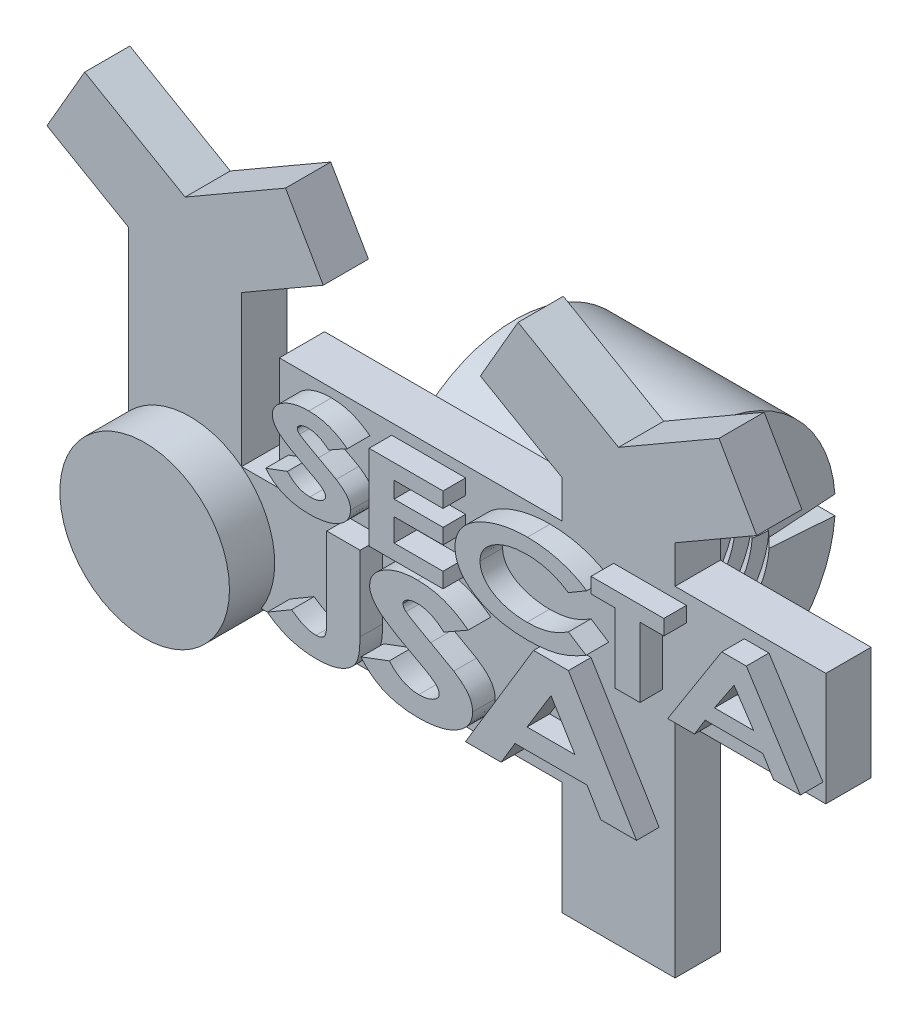
from build123d import *

# Parameters (mm, degrees)
SALIENTE_EXTRUIR1_DEPTH      = 2.4
SALIENTE_EXTRUIR2_DEPTH      = 2.4
SALIENTE_EXTRUIR2_DEPTH_BACK = 2.4
CROQUIS2_R                   = 4.5
SALIENTE_EXTRUIR3_DEPTH      = 1.2
SALIENTE_EXTRUIR4_START      = -15.5
SALIENTE_EXTRUIR4_DEPTH      = 10
REVOLUCI_N2_ANGLE            = 351.828766
SALIENTE_EXTRUIR5_DEPTH      = 1.2


# Read off the part's stored shape, not the designer's step: Revolución2
with BuildPart() as part:
    # Croquis1 → Saliente-Extruir1 (new body)
    with BuildSketch(Plane.XY):
        Polygon((-8, -12), (-14, -12), (-14, -6), (-37, -6), (-37, 8), (-41.330127019, 10.5), (-39.330127019, 13.964101615), (-34, 10.886751346), (-28.669872981, 13.964101615), (-26.669872981, 10.5), (-31, 8), (-31, 0), (-29, 0), (-29, 6), (-14, 6), (-14, 8), (-18.330127019, 10.5), (-16.330127019, 13.964101615), (-11, 10.886751346), (-5.669872981, 13.964101615), (-3.669872981, 10.5), (-8, 8), (-8, 6), (0, 6), (0, 0), (-8, 0), align=None)
    extrude(amount=SALIENTE_EXTRUIR1_DEPTH)

    # Croquis2 → Saliente-Extruir2 (add, two sides: drawn at the far end of the back side and taken through both)
    with BuildSketch(Plane.XY.offset(2.4).offset(-SALIENTE_EXTRUIR2_DEPTH_BACK)):
        with Locations((-33.744908232, -3.565877002)):
            Circle(CROQUIS2_R)
    extrude(amount=SALIENTE_EXTRUIR2_DEPTH + SALIENTE_EXTRUIR2_DEPTH_BACK)

    # Croquis4 → Saliente-Extruir3 (add)
    # profile 1 of 5: a face of its own
    with BuildSketch(Plane.XY.offset(2.4)):
        with BuildLine():
            Line((-24.192307692, 4.825075565), (-25.183894231, 4.27249143))
            add(Edge.make_bspline(
                [(-25.183894231, 4.27249143), (-25.226919521, 4.309235401), (-25.310921586, 4.380973891), (-25.44300624, 4.474503478), (-25.57494017, 4.554736812), (-25.707934149, 4.620047496), (-25.841884622, 4.67105453), (-25.976583426, 4.707083688), (-26.111905597, 4.729870519), (-26.20243685, 4.732645607), (-26.247596154, 4.734029892)],
                knots=[0, 0, 0, 0, 1.144796943, 2.235087903, 3.271950806, 4.267549238, 5.230026978, 6.168390537, 7.086346384, 8, 8, 8, 8], degree=3))
            add(Edge.make_bspline(
                [(-26.247596154, 4.734029892), (-26.289424602, 4.733153893), (-26.369562474, 4.731475594), (-26.484031555, 4.714354255), (-26.586771926, 4.685665755), (-26.6761846, 4.647005328), (-26.748660996, 4.600831216), (-26.803911953, 4.552167689), (-26.838911098, 4.497375224), (-26.84382007, 4.457984847), (-26.846153846, 4.439258257)],
                knots=[0, 0, 0, 0, 1.392129176, 2.667138632, 3.84227936, 4.935454925, 5.89858118, 6.691521191, 7.377935727, 8, 8, 8, 8], degree=3))
            add(Edge.make_bspline(
                [(-26.846153846, 4.439258257), (-26.844845537, 4.420373796), (-26.842149476, 4.381458201), (-26.816134665, 4.325733024), (-26.777704966, 4.271256116), (-26.742929276, 4.240270627), (-26.724459135, 4.223813546)],
                knots=[0, 0, 0, 0, 0.882707917, 1.819014285, 2.841630067, 4, 4, 4, 4], degree=3))
            add(Edge.make_bspline(
                [(-26.724459135, 4.223813546), (-26.70716928, 4.210697442), (-26.66689923, 4.180148536), (-26.59337581, 4.132820466), (-26.500289619, 4.0742192), (-26.385267259, 4.007155467), (-26.250202075, 3.929117481), (-26.092994818, 3.843681459), (-25.91659167, 3.74531642), (-25.790990693, 3.678511715), (-25.724759615, 3.643284699)],
                knots=[0, 0, 0, 0, 0.450074539, 1.048275106, 1.812777656, 2.732189609, 3.810011812, 5.048794557, 6.443789853, 8, 8, 8, 8], degree=3))
            add(Edge.make_bspline(
                [(-25.724759615, 3.643284699), (-25.662851598, 3.61054962), (-25.545567289, 3.548533238), (-25.379215317, 3.460234009), (-25.232592385, 3.380629208), (-25.104381152, 3.311837263), (-24.996313352, 3.251000464), (-24.90672063, 3.20082688), (-24.836479309, 3.15950506), (-24.796241404, 3.134624323), (-24.779146635, 3.12405393)],
                knots=[0, 0, 0, 0, 1.557729856, 2.951108395, 4.189202345, 5.268860485, 6.187465346, 6.947688418, 7.552933379, 8, 8, 8, 8], degree=3))
            add(Edge.make_bspline(
                [(-24.779146635, 3.12405393), (-24.745624529, 3.102367723), (-24.680599264, 3.060301409), (-24.588625488, 2.994912237), (-24.503390955, 2.931503644), (-24.427229566, 2.867043774), (-24.357014925, 2.805015658), (-24.29466236, 2.742739252), (-24.239952943, 2.680948997), (-24.177464976, 2.600954471), (-24.114353967, 2.498189698), (-24.058957494, 2.368077238), (-24.025432867, 2.231810055), (-24.021303487, 2.138659077), (-24.019230769, 2.091902488)],
                knots=[0, 0, 0, 0, 1.070878652, 2.077261218, 3.026806543, 3.919535016, 4.752941277, 5.539501526, 6.28186576, 6.965498631, 8.260851439, 9.503440935, 10.746866769, 12, 12, 12, 12], degree=3))
            add(Edge.make_bspline(
                [(-24.019230769, 2.091902488), (-24.021225883, 2.046388603), (-24.025162066, 1.956593709), (-24.053916989, 1.824825276), (-24.101962891, 1.699615496), (-24.170078124, 1.580956355), (-24.25688378, 1.468643362), (-24.361997442, 1.361487696), (-24.488019379, 1.263070384), (-24.629645969, 1.169520308), (-24.787082803, 1.085611466), (-24.956963559, 1.011461598), (-25.138821289, 0.94934789), (-25.33212297, 0.899368812), (-25.536835489, 0.859635813), (-25.752947944, 0.83114072), (-25.980779388, 0.81366997), (-26.136386151, 0.811872926), (-26.216045673, 0.810952969)],
                knots=[0, 0, 0, 0, 0.778645729, 1.536199556, 2.296471887, 3.065788088, 3.869161519, 4.720163113, 5.627776405, 6.600599383, 7.622238928, 8.677086202, 9.770036052, 10.907689888, 12.091823603, 13.337058766, 14.636764725, 16, 16, 16, 16], degree=3))
            add(Edge.make_bspline(
                [(-26.216045673, 0.810952969), (-26.278862692, 0.811613903), (-26.402188738, 0.812911487), (-26.584138058, 0.824072309), (-26.75981156, 0.841825212), (-26.929760665, 0.867140244), (-27.09350231, 0.899245573), (-27.251131566, 0.939142332), (-27.402545238, 0.985888772), (-27.54819372, 1.039742336), (-27.687679504, 1.102538784), (-27.822154113, 1.17262053), (-27.951366726, 1.251594628), (-28.076264597, 1.337864302), (-28.194814057, 1.433872974), (-28.309206927, 1.536758813), (-28.417527902, 1.648872099), (-28.485118563, 1.728831552), (-28.519230769, 1.769186142)],
                knots=[0, 0, 0, 0, 1.1656978, 2.288566092, 3.381684239, 4.4416263, 5.476209922, 6.477059963, 7.457759757, 8.415892537, 9.356930802, 10.29479133, 11.228214832, 12.165660798, 13.10971789, 14.057260176, 15.019522194, 16, 16, 16, 16], degree=3))
            Line((-28.519230769, 1.769186142), (-27.369891827, 2.195568353))
            add(Edge.make_bspline(
                [(-27.369891827, 2.195568353), (-27.326878803, 2.149617425), (-27.242766395, 2.059759915), (-27.104823389, 1.942623324), (-26.962827441, 1.842220632), (-26.815241766, 1.760731057), (-26.662944246, 1.696978834), (-26.505695985, 1.651714203), (-26.343252193, 1.623681536), (-26.232984667, 1.620335505), (-26.177283654, 1.618645276)],
                knots=[0, 0, 0, 0, 1.104549774, 2.159958392, 3.171518491, 4.154034384, 5.11440821, 6.064653456, 7.02237072, 8, 8, 8, 8], degree=3))
            add(Edge.make_bspline(
                [(-26.177283654, 1.618645276), (-26.120989658, 1.62005089), (-26.012343754, 1.622763687), (-25.85664514, 1.64771586), (-25.713942821, 1.686386449), (-25.607218871, 1.734622992), (-25.53095931, 1.778258902), (-25.482277778, 1.812604775), (-25.440114595, 1.847701985), (-25.405740827, 1.884529266), (-25.378809327, 1.92260654), (-25.360756038, 1.962489796), (-25.347985789, 2.003075864), (-25.346761569, 2.031110582), (-25.346153846, 2.045027488)],
                knots=[0, 0, 0, 0, 2.000080528, 3.860101882, 5.591711695, 7.241573856, 8.007496713, 8.712915002, 9.3571957, 9.95440764, 10.499672279, 11.006310789, 11.506715953, 12, 12, 12, 12], degree=3))
            add(Edge.make_bspline(
                [(-25.346153846, 2.045027488), (-25.348239201, 2.070942283), (-25.352586387, 2.124964954), (-25.390964671, 2.203007862), (-25.448179949, 2.280722516), (-25.514214503, 2.343308112), (-25.582059449, 2.395058844), (-25.647383562, 2.441422812), (-25.726444628, 2.492094868), (-25.819005406, 2.548325637), (-25.925335169, 2.609220624), (-26.044860486, 2.67577012), (-26.17800202, 2.747266769), (-26.271568792, 2.795754085), (-26.320612981, 2.821169315)],
                knots=[0, 0, 0, 0, 0.719620744, 1.500140495, 2.382110041, 3.407752025, 4.023146351, 4.762800511, 5.641737031, 6.64237355, 7.784062873, 9.059959673, 10.45894125, 12, 12, 12, 12], degree=3))
            add(Edge.make_bspline(
                [(-26.320612981, 2.821169315), (-26.368459463, 2.84567455), (-26.462008447, 2.89358695), (-26.598052081, 2.966124363), (-26.728282458, 3.035606872), (-26.852361866, 3.102717503), (-26.969340368, 3.16861793), (-27.079874913, 3.232097137), (-27.184213841, 3.292789495), (-27.281477135, 3.352655417), (-27.372939784, 3.409563727), (-27.457987116, 3.463803993), (-27.536153138, 3.516806133), (-27.608250882, 3.56691886), (-27.673715651, 3.615399427), (-27.732827542, 3.661463412), (-27.784903573, 3.705640291), (-27.845809442, 3.760123378), (-27.91153798, 3.827869305), (-27.981090217, 3.909608617), (-28.039650506, 3.991311051), (-28.088116794, 4.07325264), (-28.126508849, 4.154820462), (-28.152520589, 4.237055511), (-28.169956374, 4.318632083), (-28.172042788, 4.37336685), (-28.173076923, 4.400496238)],
                knots=[0, 0, 0, 0, 1.527752317, 2.987046655, 4.381534809, 5.722815918, 6.996037519, 8.197198144, 9.345466108, 10.426340658, 11.442891163, 12.407010941, 13.292840506, 14.126765819, 14.902190045, 15.60773904, 16.256140062, 16.842652159, 17.929649168, 18.935598672, 19.890598399, 20.782540177, 21.638432253, 22.445922123, 23.229718433, 24, 24, 24, 24], degree=3))
            add(Edge.make_bspline(
                [(-28.173076923, 4.400496238), (-28.171332958, 4.439115335), (-28.167872434, 4.515746655), (-28.140274372, 4.628176318), (-28.096954996, 4.736645399), (-28.034402099, 4.840036268), (-27.954790236, 4.939178338), (-27.857594728, 5.03372198), (-27.743147048, 5.123864571), (-27.613030887, 5.208721489), (-27.469978861, 5.28611098), (-27.317394775, 5.354995406), (-27.156225026, 5.412373324), (-26.987382795, 5.460394313), (-26.810220466, 5.497174122), (-26.625035089, 5.523120736), (-26.431752744, 5.538517619), (-26.300208347, 5.540640417), (-26.233173077, 5.541722199)],
                knots=[0, 0, 0, 0, 0.750986067, 1.490170878, 2.240724014, 3.017156197, 3.83291239, 4.709793601, 5.650705905, 6.664670556, 7.729957895, 8.813839263, 9.920261115, 11.057155333, 12.228423976, 13.439459984, 14.695144019, 16, 16, 16, 16], degree=3))
            add(Edge.make_bspline(
                [(-26.233173077, 5.541722199), (-26.1459499, 5.539811999), (-25.973426712, 5.536033716), (-25.71789947, 5.506014802), (-25.468743649, 5.458927461), (-25.265554368, 5.401927605), (-25.104286181, 5.345639344), (-24.980879285, 5.295174591), (-24.855593259, 5.235928582), (-24.726973154, 5.170437519), (-24.596827454, 5.094993964), (-24.463217184, 5.013324641), (-24.327779063, 4.922853281), (-24.238080357, 4.85811241), (-24.192307692, 4.825075565)],
                knots=[0, 0, 0, 0, 1.424089512, 2.816779558, 4.195891129, 5.561527259, 6.25835624, 6.984627267, 7.737611116, 8.521108524, 9.34096556, 10.193521101, 11.07816558, 12, 12, 12, 12], degree=3))
        make_face()
    # profile 2 of 5: a face of its own
    with BuildSketch(Plane.XY.offset(2.4)):
        Polygon((-23.035576923, 5.426337584), (-19.1125, 5.426337584), (-19.1125, 4.618645276), (-21.708653846, 4.618645276), (-21.708653846, 3.753260661), (-19.1125, 3.753260661), (-19.1125, 2.945568353), (-21.708653846, 2.945568353), (-21.708653846, 1.734029892), (-19.1125, 1.734029892), (-19.1125, 0.926337584), (-23.035576923, 0.926337584), align=None)
    # profile 3 of 5: a face of its own
    with BuildSketch(Plane.XY.offset(2.4)):
        with BuildLine():
            Line((-11.494230769, 4.645688546), (-12.461478365, 4.079582776))
            add(Edge.make_bspline(
                [(-12.461478365, 4.079582776), (-12.544289436, 4.131887712), (-12.70893723, 4.235882169), (-12.967709373, 4.369570214), (-13.2349627, 4.481070871), (-13.508945238, 4.574844948), (-13.791643594, 4.64568237), (-14.081359757, 4.697070998), (-14.379043474, 4.728675173), (-14.580090964, 4.732231823), (-14.681730769, 4.734029892)],
                knots=[0, 0, 0, 0, 1.000465043, 1.98915872, 2.971640436, 3.957111076, 4.945256385, 5.94622067, 6.961709345, 8, 8, 8, 8], degree=3))
            add(Edge.make_bspline(
                [(-14.681730769, 4.734029892), (-14.766807302, 4.732614733), (-14.933613121, 4.729840095), (-15.178736129, 4.708948819), (-15.41352726, 4.673751146), (-15.638708179, 4.625507751), (-15.853448947, 4.562274824), (-16.058280977, 4.48569033), (-16.25235326, 4.394501415), (-16.434067486, 4.290723345), (-16.600277398, 4.177562223), (-16.746196027, 4.055929366), (-16.870201552, 3.927577603), (-16.971329203, 3.792162), (-17.051341788, 3.650423272), (-17.107374496, 3.501164008), (-17.142253146, 3.345315182), (-17.146123081, 3.239018692), (-17.148076923, 3.185352007)],
                knots=[0, 0, 0, 0, 1.273167119, 2.496242804, 3.678550535, 4.824339787, 5.939965159, 7.025799381, 8.094030328, 9.145459928, 10.154579224, 11.099447358, 11.983659447, 12.819211474, 13.622469174, 14.41092516, 15.197712182, 16, 16, 16, 16], degree=3))
            add(Edge.make_bspline(
                [(-17.148076923, 3.185352007), (-17.147415614, 3.147727083), (-17.146108387, 3.073352918), (-17.129475318, 2.96370395), (-17.106065882, 2.856804626), (-17.070101266, 2.75393244), (-17.025862091, 2.65391101), (-16.971328936, 2.557174091), (-16.907261742, 2.463244728), (-16.833169017, 2.37324015), (-16.74995472, 2.287330187), (-16.657794645, 2.206639788), (-16.558275277, 2.129695963), (-16.45080782, 2.057129788), (-16.334226304, 1.991157083), (-16.210216908, 1.928324455), (-16.077791861, 1.871334993), (-15.938537212, 1.817777173), (-15.792564168, 1.771701839), (-15.642458064, 1.729774273), (-15.487700082, 1.69568223), (-15.329102464, 1.668203354), (-15.166867918, 1.644955994), (-15.000433419, 1.63053195), (-14.830012806, 1.619621949), (-14.714802376, 1.618973486), (-14.656490385, 1.618645276)],
                knots=[0, 0, 0, 0, 0.830945717, 1.642551973, 2.446594014, 3.246896049, 4.046756933, 4.861591236, 5.698014292, 6.556999256, 7.435410672, 8.338952563, 9.262321444, 10.214761384, 11.20258315, 12.221471147, 13.286409055, 14.388022435, 15.518142965, 16.668710983, 17.832243558, 19.019275871, 20.22635821, 21.453738207, 22.71124865, 24, 24, 24, 24], degree=3))
            add(Edge.make_bspline(
                [(-14.656490385, 1.618645276), (-14.558479025, 1.620411909), (-14.366006122, 1.623881189), (-14.084005172, 1.650038065), (-13.814796067, 1.694421697), (-13.598352905, 1.745650094), (-13.428470487, 1.797304223), (-13.29967663, 1.845079594), (-13.16705737, 1.897774166), (-13.031696922, 1.95876245), (-12.892716193, 2.025958407), (-12.751716033, 2.102246686), (-12.606883075, 2.184160309), (-12.51058721, 2.243056557), (-12.461478365, 2.273092392)],
                knots=[0, 0, 0, 0, 1.517099692, 2.97925243, 4.379421106, 5.737784246, 6.419017464, 7.126793621, 7.863581755, 8.627744198, 9.42450828, 10.252748223, 11.108938718, 12, 12, 12, 12], degree=3))
            Line((-12.461478365, 2.273092392), (-11.523978365, 1.670027488))
            add(Edge.make_bspline(
                [(-11.523978365, 1.670027488), (-11.589866389, 1.63089097), (-11.719693426, 1.55377562), (-11.915195728, 1.446317988), (-12.108473976, 1.34948377), (-12.297754192, 1.259261056), (-12.485165811, 1.179927018), (-12.670221171, 1.111080552), (-12.851582723, 1.048595885), (-13.032422653, 0.997560002), (-13.21480409, 0.952437403), (-13.402047536, 0.915306611), (-13.595238215, 0.882366907), (-13.794974582, 0.856691538), (-14.000848718, 0.835695517), (-14.213133376, 0.821796079), (-14.43134112, 0.812187513), (-14.578955449, 0.81136827), (-14.653786058, 0.810952969)],
                knots=[0, 0, 0, 0, 1.116919084, 2.20079896, 3.250609473, 4.267388355, 5.256504417, 6.215552819, 7.144850743, 8.051425286, 8.95323759, 9.882566473, 10.832956071, 11.809130983, 12.817090507, 13.848664173, 14.909416376, 16, 16, 16, 16], degree=3))
            add(Edge.make_bspline(
                [(-14.653786058, 0.810952969), (-14.722906065, 0.811438621), (-14.859691786, 0.812399709), (-15.062555949, 0.821077022), (-15.260983826, 0.833250386), (-15.454582999, 0.851296303), (-15.643403282, 0.874597786), (-15.827259539, 0.903853507), (-16.00674088, 0.936332544), (-16.180825441, 0.976788095), (-16.350605366, 1.020454944), (-16.515219787, 1.070284035), (-16.675796791, 1.124137214), (-16.830986852, 1.184720215), (-16.98194907, 1.249284398), (-17.127583541, 1.320151969), (-17.268666888, 1.395536662), (-17.404785058, 1.475557845), (-17.533832281, 1.55977608), (-17.655328935, 1.647304488), (-17.767608154, 1.738530782), (-17.872942194, 1.831381532), (-17.969705449, 1.927659287), (-18.056733746, 2.028066389), (-18.136984543, 2.130125749), (-18.207982429, 2.23578825), (-18.271536331, 2.343875109), (-18.325588208, 2.45528507), (-18.371881381, 2.569350723), (-18.409889173, 2.686463496), (-18.438566401, 2.80681331), (-18.459258447, 2.929679867), (-18.472299239, 3.055565471), (-18.474092593, 3.140548909), (-18.475, 3.183549122)],
                knots=[0, 0, 0, 0, 1.332695775, 2.637351488, 3.914573827, 5.165626706, 6.385872522, 7.582268218, 8.755001435, 9.901903064, 11.027533841, 12.134657037, 13.217484645, 14.292362361, 15.346028539, 16.38254251, 17.414187142, 18.429713001, 19.426050768, 20.38448865, 21.315585414, 22.214377371, 23.09110566, 23.945180852, 24.774994998, 25.592932072, 26.397837579, 27.190746929, 27.978303889, 28.769836126, 29.562406716, 30.361557218, 31.170975064, 32, 32, 32, 32], degree=3))
            add(Edge.make_bspline(
                [(-18.475, 3.183549122), (-18.473785493, 3.238925736), (-18.471371684, 3.348985679), (-18.446835338, 3.511020848), (-18.408980933, 3.668635775), (-18.355790343, 3.821267368), (-18.28636546, 3.9692084), (-18.202723551, 4.112393918), (-18.103189381, 4.250700647), (-17.988581396, 4.383672271), (-17.859872774, 4.511467458), (-17.71720785, 4.632192986), (-17.563026633, 4.748488266), (-17.393828314, 4.855888833), (-17.21236255, 4.957872305), (-17.017950151, 5.05352182), (-16.810256436, 5.142613144), (-16.59063275, 5.224912925), (-16.362332555, 5.299148216), (-16.12837035, 5.364251973), (-15.889855412, 5.419259798), (-15.647178925, 5.464408476), (-15.399824695, 5.498220768), (-15.148529856, 5.52396688), (-14.892531391, 5.538130641), (-14.720508462, 5.540519988), (-14.633954327, 5.541722199)],
                knots=[0, 0, 0, 0, 0.802734483, 1.595419208, 2.3713548, 3.151550955, 3.93542733, 4.738280132, 5.553519112, 6.40352961, 7.281897666, 8.181549112, 9.112540013, 10.080976543, 11.086002615, 12.130796417, 13.222189586, 14.362844853, 15.53167316, 16.70335042, 17.8843298, 19.081152094, 20.282513389, 21.504662868, 22.744459539, 24, 24, 24, 24], degree=3))
            add(Edge.make_bspline(
                [(-14.633954327, 5.541722199), (-14.560022202, 5.541038651), (-14.412680101, 5.539676383), (-14.192915704, 5.528419291), (-13.974866237, 5.510811627), (-13.759430794, 5.484144557), (-13.545483627, 5.45221806), (-13.334339569, 5.411070758), (-13.124506008, 5.364772576), (-12.918162654, 5.309484781), (-12.715876611, 5.248900726), (-12.520332919, 5.18093532), (-12.331084533, 5.108255242), (-12.149648163, 5.028005632), (-11.974851405, 4.94211841), (-11.807351876, 4.850530483), (-11.646999565, 4.75209108), (-11.544984001, 4.681037862), (-11.494230769, 4.645688546)],
                knots=[0, 0, 0, 0, 1.07027023, 2.132981633, 3.184963682, 4.2365859, 5.275089204, 6.31594048, 7.35020766, 8.385325281, 9.407824875, 10.406591267, 11.38165812, 12.34189163, 13.277662355, 14.200461515, 15.104720988, 16, 16, 16, 16], degree=3))
        make_face()
    # profile 4 of 5: a face of its own
    with BuildSketch(Plane.XY.offset(2.4)):
        Polygon((-11.260576923, 5.426337584), (-7.395192308, 5.426337584), (-7.395192308, 4.618645276), (-8.664423077, 4.618645276), (-8.664423077, 0.926337584), (-9.991346154, 0.926337584), (-9.991346154, 4.618645276), (-11.260576923, 4.618645276), align=None)
    # profile 5 of 5: a face of its own
    with BuildSketch(Plane.XY.offset(2.4)):
        Polygon((-4.322896635, 5.426337584), (-3.017608173, 5.426337584), (-0.151923077, 0.926337584), (-1.574399038, 0.926337584), (-2.138701923, 1.849414507), (-5.204507212, 1.849414507), (-5.768810096, 0.926337584), (-7.190384615, 0.926337584), align=None)
        Polygon((-3.671153846, 4.219306334), (-4.710516827, 2.657106815), (-2.631790865, 2.657106815), align=None, mode=Mode.SUBTRACT)
    extrude(amount=SALIENTE_EXTRUIR3_DEPTH)

    # Croquis5 → Saliente-Extruir4 (add)
    with BuildSketch(Plane.ZY.offset(29).offset(SALIENTE_EXTRUIR4_START)):
        with BuildLine():
            Line((0, 5.276362383), (0, -5.276362383))
            ThreePointArc((0, -5.276362383), (-7.269302632, -6.471075912), (-11.582210899, -0.49872935))
            Line((-11.582210899, -0.49872935), (-9.088564149, -0.320611725))
            ThreePointArc((-9.088564149, -0.320611725), (-0.1, 0), (-9.088564149, 0.320611725))
            Line((-9.088564149, 0.320611725), (-11.582210899, 0.49872935))
            ThreePointArc((-11.582210899, 0.49872935), (-7.269302632, 6.471075912), (0, 5.276362383))
        make_face()
    extrude(amount=SALIENTE_EXTRUIR4_DEPTH)

    # Revolución2 outline → Revolución2 (revolve)
    with BuildSketch(Plane(origin=(0, 0, -4.6), x_dir=(0, 0.07124704998789502, -0.9974586998307361), z_dir=(0, -0.9974586998307361, -0.07124704998789502))):
        Polygon((4.4, -22.6), (3.5, -23.5), (4.5, -23.5), (4.5, -18.9), (3.5, -19.9), (4.4, -19.9), (3.5, -20.8), (4.4, -20.8), (3.5, -21.7), (4.4, -21.7), (3.5, -22.6), align=None)
        Polygon((3.5, -17.1), (4.5, -18.1), (4.5, -13.5), (3.5, -13.5), (4.4, -14.4), (3.5, -14.4), (4.4, -15.3), (3.5, -15.3), (4.4, -16.2), (3.5, -16.2), (4.4, -17.1), align=None)
    revolve(axis=Axis((0, 0, -4.6), (1, 0, 0)), revolution_arc=REVOLUCI_N2_ANGLE)

    # Croquis8 → Saliente-Extruir5 (add)
    # profile 1 of 3: a face of its own
    with BuildSketch(Plane.XY.offset(2.4)):
        with BuildLine():
            Line((-25.283369771, 0.5), (-23.514139002, 0.5))
            Line((-23.514139002, 0.5), (-23.514139002, -3.483173077))
            add(Edge.make_bspline(
                [(-23.514139002, -3.483173077), (-23.514763901, -3.559310957), (-23.51596834, -3.706059909), (-23.526974415, -3.917338613), (-23.543884806, -4.111249863), (-23.570937821, -4.286763534), (-23.602048675, -4.445448568), (-23.643313184, -4.585785394), (-23.688823682, -4.709946518), (-23.74583379, -4.817042142), (-23.810948948, -4.912106881), (-23.884021861, -5.001121341), (-23.96661189, -5.084659641), (-24.059300003, -5.163544877), (-24.160807881, -5.237715961), (-24.272680983, -5.306127945), (-24.392512481, -5.371487858), (-24.522520116, -5.429818694), (-24.660090004, -5.482638856), (-24.805186719, -5.527942977), (-24.956480251, -5.568434525), (-25.115375874, -5.598380719), (-25.280340201, -5.62477493), (-25.452618845, -5.640326781), (-25.631367248, -5.651979896), (-25.752900131, -5.653217596), (-25.814619771, -5.653846154)],
                knots=[0, 0, 0, 0, 1.485066527, 2.862332854, 4.126023606, 5.279918962, 6.325224735, 7.277424959, 8.130853912, 8.899963085, 9.636954324, 10.375435773, 11.143591406, 11.925147029, 12.747375238, 13.593184137, 14.481366606, 15.408213602, 16.370495027, 17.354212976, 18.372136405, 19.423559388, 20.506742452, 21.629654192, 22.796236172, 24, 24, 24, 24], degree=3))
            add(Edge.make_bspline(
                [(-25.814619771, -5.653846154), (-25.940529685, -5.651388431), (-26.188582191, -5.646546522), (-26.553053209, -5.605874985), (-26.903832403, -5.540521946), (-27.239559422, -5.445908451), (-27.562462225, -5.327625987), (-27.86917931, -5.179365102), (-28.164160634, -5.008614759), (-28.345929507, -4.872463344), (-28.437215925, -4.804086538)],
                knots=[0, 0, 0, 0, 1.075215121, 2.118258982, 3.128373899, 4.11976511, 5.094267793, 6.061648089, 7.026537389, 8, 8, 8, 8], degree=3))
            Line((-28.437215925, -4.804086538), (-27.152360155, -4.050480769))
            add(Edge.make_bspline(
                [(-27.152360155, -4.050480769), (-27.084828946, -4.099019269), (-26.956791575, -4.191046968), (-26.767096758, -4.307927643), (-26.59506978, -4.403273433), (-26.43422769, -4.470787816), (-26.282459383, -4.517866592), (-26.13604495, -4.552695902), (-25.991813369, -4.57189243), (-25.89639969, -4.575264636), (-25.84947554, -4.576923077)],
                knots=[0, 0, 0, 0, 1.39465022, 2.644219589, 3.735770951, 4.69065003, 5.56428105, 6.398991461, 7.21262899, 8, 8, 8, 8], degree=3))
            add(Edge.make_bspline(
                [(-25.84947554, -4.576923077), (-25.804812902, -4.575407314), (-25.719949582, -4.572527219), (-25.602141895, -4.542391628), (-25.50178427, -4.493441885), (-25.432670245, -4.435126578), (-25.388345197, -4.374436521), (-25.360636446, -4.316809047), (-25.336374294, -4.247848732), (-25.316457944, -4.167764897), (-25.300945541, -4.075355975), (-25.290660371, -3.971757383), (-25.284873461, -3.856235916), (-25.283888767, -3.775647979), (-25.283369771, -3.733173077)],
                knots=[0, 0, 0, 0, 1.360096507, 2.584314528, 3.677431692, 4.743220926, 5.303010057, 5.958880355, 6.685618319, 7.530400593, 8.472718946, 9.541656752, 10.704298757, 12, 12, 12, 12], degree=3))
            Line((-25.283369771, -3.733173077), (-25.283369771, 0.5))
        make_face()
    # profile 2 of 3: a face of its own
    with BuildSketch(Plane.XY.offset(2.4)):
        with BuildLine():
            Line((-17.775677463, -0.301682692), (-19.068946694, -1.038461538))
            add(Edge.make_bspline(
                [(-19.068946694, -1.038461538), (-19.12510697, -0.989482608), (-19.234680182, -0.893920777), (-19.407182659, -0.769193129), (-19.579476095, -0.662212022), (-19.753182724, -0.575074643), (-19.927856229, -0.507318906), (-20.103340944, -0.458835393), (-20.27944411, -0.428724435), (-20.397357856, -0.424951987), (-20.455965925, -0.423076923)],
                knots=[0, 0, 0, 0, 1.151463833, 2.246598481, 3.286540075, 4.283679302, 5.246389907, 6.177996593, 7.094388031, 8, 8, 8, 8], degree=3))
            add(Edge.make_bspline(
                [(-20.455965925, -0.423076923), (-20.510533529, -0.424272318), (-20.615385699, -0.426569279), (-20.764877423, -0.449119998), (-20.899046658, -0.487712427), (-21.015579584, -0.539512226), (-21.111101868, -0.600104943), (-21.182001128, -0.666400849), (-21.229138642, -0.738417911), (-21.234616006, -0.791099573), (-21.237215925, -0.816105769)],
                knots=[0, 0, 0, 0, 1.383181381, 2.657796193, 3.821791152, 4.913283996, 5.882753412, 6.673190753, 7.370208683, 8, 8, 8, 8], degree=3))
            add(Edge.make_bspline(
                [(-21.237215925, -0.816105769), (-21.235386803, -0.841252865), (-21.23162878, -0.892918856), (-21.198596002, -0.967416884), (-21.148429198, -1.040079015), (-21.102791994, -1.081417673), (-21.078562079, -1.103365385)],
                knots=[0, 0, 0, 0, 0.887965238, 1.824369859, 2.84490435, 4, 4, 4, 4], degree=3))
            add(Edge.make_bspline(
                [(-21.078562079, -1.103365385), (-21.056352327, -1.120906181), (-21.00421749, -1.162081184), (-20.907569326, -1.224348093), (-20.785830758, -1.303024783), (-20.635009631, -1.392050468), (-20.458772285, -1.495777147), (-20.254339321, -1.611107902), (-20.023512831, -1.740736832), (-19.859510234, -1.830306108), (-19.773273617, -1.877403846)],
                knots=[0, 0, 0, 0, 0.447024127, 1.04933773, 1.815120696, 2.738070006, 3.816358118, 5.046944529, 6.447210492, 8, 8, 8, 8], degree=3))
            add(Edge.make_bspline(
                [(-19.773273617, -1.877403846), (-19.692312454, -1.921014977), (-19.539061234, -2.003566399), (-19.321885262, -2.121709269), (-19.130161289, -2.227411623), (-18.962664351, -2.3195957), (-18.821112828, -2.400230374), (-18.703979837, -2.467683054), (-18.611822191, -2.521951727), (-18.559654326, -2.555564013), (-18.537696694, -2.569711538)],
                knots=[0, 0, 0, 0, 1.558035923, 2.949203027, 4.188692445, 5.267303, 6.188380665, 6.94865321, 7.557484549, 8, 8, 8, 8], degree=3))
            add(Edge.make_bspline(
                [(-18.537696694, -2.569711538), (-18.494289314, -2.598755277), (-18.409579343, -2.655434448), (-18.28847191, -2.741385312), (-18.177193593, -2.826933637), (-18.076802634, -2.911874584), (-17.985703915, -2.995588165), (-17.903561249, -3.077658648), (-17.833225524, -3.160928698), (-17.751231829, -3.267099773), (-17.669516309, -3.404630158), (-17.596483431, -3.577717108), (-17.553503169, -3.759536758), (-17.547782051, -3.883596208), (-17.544908232, -3.945913462)],
                knots=[0, 0, 0, 0, 1.058886312, 2.066428072, 3.010405479, 3.903820285, 4.731645146, 5.518566705, 6.256013361, 6.939983944, 8.236938558, 9.486000467, 10.737173618, 12, 12, 12, 12], degree=3))
            add(Edge.make_bspline(
                [(-17.544908232, -3.945913462), (-17.546901215, -4.006644231), (-17.550836897, -4.126573543), (-17.59189416, -4.301596967), (-17.653762267, -4.468927603), (-17.743595969, -4.627157446), (-17.85810165, -4.776521682), (-17.995748195, -4.919826483), (-18.161489015, -5.051002872), (-18.347892068, -5.17579751), (-18.555191972, -5.28729388), (-18.778607069, -5.386852149), (-19.01777645, -5.468824898), (-19.272060221, -5.5363963), (-19.541178588, -5.588626973), (-19.825647307, -5.627076355), (-20.125450927, -5.650197291), (-20.330523625, -5.652610464), (-20.435533232, -5.653846154)],
                knots=[0, 0, 0, 0, 0.785386359, 1.55095754, 2.316317596, 3.09009509, 3.897648887, 4.749166546, 5.656962947, 6.630003971, 7.651827797, 8.702041743, 9.795146261, 10.923103635, 12.107848954, 13.343865379, 14.639898643, 16, 16, 16, 16], degree=3))
            add(Edge.make_bspline(
                [(-20.435533232, -5.653846154), (-20.518087216, -5.652957447), (-20.680519756, -5.651208835), (-20.920319435, -5.636364162), (-21.152142326, -5.612658029), (-21.375979489, -5.579095034), (-21.591422355, -5.535918688), (-21.798513901, -5.483176365), (-21.997447859, -5.420350254), (-22.188922424, -5.3488018), (-22.372545591, -5.265117764), (-22.549526924, -5.171172696), (-22.720239915, -5.067132007), (-22.883553323, -4.950389657), (-23.040306391, -4.823792402), (-23.190357053, -4.68561872), (-23.333650724, -4.53665843), (-23.422923355, -4.430026241), (-23.467985155, -4.376201923)],
                knots=[0, 0, 0, 0, 1.160736759, 2.283856113, 3.37695986, 4.436612623, 5.465215934, 6.46539501, 7.440004787, 8.397398946, 9.337802332, 10.27529885, 11.213472188, 12.146693455, 13.096031512, 14.04495159, 15.013157774, 16, 16, 16, 16], degree=3))
            Line((-23.467985155, -4.376201923), (-21.964379386, -3.807692308))
            add(Edge.make_bspline(
                [(-21.964379386, -3.807692308), (-21.907771493, -3.86887496), (-21.79733065, -3.988241064), (-21.616961505, -4.14531314), (-21.430240449, -4.278363392), (-21.236976603, -4.38747689), (-21.037460681, -4.472434585), (-20.831398959, -4.532829906), (-20.618780638, -4.570137655), (-20.474545591, -4.574649827), (-20.401879386, -4.576923077)],
                knots=[0, 0, 0, 0, 1.112264183, 2.170004676, 3.18669602, 4.168670381, 5.127423448, 6.075296164, 7.030326369, 8, 8, 8, 8], degree=3))
            add(Edge.make_bspline(
                [(-20.401879386, -4.576923077), (-20.328019375, -4.575052892), (-20.185542268, -4.571445275), (-19.98153241, -4.538166768), (-19.794780328, -4.48665497), (-19.655469054, -4.422055262), (-19.55570194, -4.364117862), (-19.49196319, -4.318326519), (-19.437032518, -4.271467432), (-19.392063312, -4.222499381), (-19.358222181, -4.170928589), (-19.331691362, -4.119041665), (-19.317039445, -4.064090646), (-19.31510304, -4.026919227), (-19.314139002, -4.008413462)],
                knots=[0, 0, 0, 0, 1.994868064, 3.848131422, 5.572077196, 7.214799191, 7.981806503, 8.688002326, 9.332834679, 9.930870741, 10.477480229, 10.995677587, 11.499998792, 12, 12, 12, 12], degree=3))
            add(Edge.make_bspline(
                [(-19.314139002, -4.008413462), (-19.317001234, -3.973894005), (-19.322954463, -3.902096141), (-19.372439765, -3.797797366), (-19.447611689, -3.694456047), (-19.533711338, -3.611222602), (-19.621461563, -3.54120101), (-19.707227507, -3.480300132), (-19.810419396, -3.411794642), (-19.932182527, -3.338023827), (-20.070633096, -3.25598176), (-20.226697057, -3.167041965), (-20.40112495, -3.072657458), (-20.523237703, -3.007544158), (-20.58697554, -2.973557692)],
                knots=[0, 0, 0, 0, 0.728698247, 1.515637342, 2.403756357, 3.430192616, 4.04002485, 4.782098419, 5.657921285, 6.663935966, 7.798033462, 9.067831563, 10.469528622, 12, 12, 12, 12], degree=3))
            add(Edge.make_bspline(
                [(-20.58697554, -2.973557692), (-20.649117419, -2.940785209), (-20.771191398, -2.876405638), (-20.949476381, -2.780641258), (-21.119493395, -2.687946418), (-21.280666274, -2.597977583), (-21.43312571, -2.509610052), (-21.578552603, -2.426427958), (-21.714606549, -2.344369106), (-21.84168969, -2.264914448), (-21.961152584, -2.189501728), (-22.07135161, -2.115980827), (-22.173949295, -2.046475029), (-22.267819635, -1.979253745), (-22.352823278, -1.914268288), (-22.430322593, -1.85321415), (-22.498522846, -1.794274115), (-22.578198762, -1.721652169), (-22.663784275, -1.630912714), (-22.755367904, -1.522332127), (-22.832157984, -1.413330223), (-22.89574472, -1.304117783), (-22.945210188, -1.195054517), (-22.98071848, -1.08589652), (-23.001891186, -0.976782598), (-23.004935961, -0.903933942), (-23.006446694, -0.867788462)],
                knots=[0, 0, 0, 0, 1.515528176, 2.977163822, 4.365653063, 5.692832444, 6.958859938, 8.167012862, 9.306831529, 10.3860253, 11.400206339, 12.354234696, 13.243591416, 14.073468891, 14.844413536, 15.55168912, 16.201329095, 16.788522835, 17.876608653, 18.889131178, 19.850646507, 20.748986645, 21.611611138, 22.428835989, 23.220432031, 24, 24, 24, 24], degree=3))
            add(Edge.make_bspline(
                [(-23.006446694, -0.867788462), (-23.003985212, -0.81632998), (-22.999105257, -0.714312123), (-22.964365312, -0.563994515), (-22.905850189, -0.419957364), (-22.824170633, -0.281691318), (-22.719045204, -0.149955262), (-22.591984362, -0.023452033), (-22.441704729, 0.096734932), (-22.270797584, 0.20947807), (-22.083245684, 0.313398012), (-21.882666212, 0.404527889), (-21.670809887, 0.481673728), (-21.44872421, 0.545190589), (-21.215781323, 0.594496129), (-20.972448448, 0.629038913), (-20.718340866, 0.649579199), (-20.545347128, 0.652405511), (-20.457167848, 0.653846154)],
                knots=[0, 0, 0, 0, 0.758500524, 1.503748172, 2.261811434, 3.043002738, 3.863249088, 4.740510202, 5.681611051, 6.695858962, 7.7562691, 8.840230686, 9.941061797, 11.077968674, 12.24361496, 13.449222666, 14.699804323, 16, 16, 16, 16], degree=3))
            add(Edge.make_bspline(
                [(-20.457167848, 0.653846154), (-20.342872598, 0.651286495), (-20.116436677, 0.64621543), (-19.780925503, 0.606236414), (-19.45350742, 0.543447997), (-19.186605436, 0.467440051), (-18.97481534, 0.392362982), (-18.812637785, 0.325145847), (-18.6478291, 0.245718731), (-18.478146129, 0.159472638), (-18.307671155, 0.057745658), (-18.132033715, -0.050645821), (-17.953912637, -0.171370179), (-17.835910066, -0.257645022), (-17.775677463, -0.301682692)],
                knots=[0, 0, 0, 0, 1.417403089, 2.808086709, 4.18525207, 5.549154529, 6.245490142, 6.971823622, 7.725409129, 8.51447216, 9.331869066, 10.186835609, 11.074498045, 12, 12, 12, 12], degree=3))
        make_face()
    # profile 3 of 3: a face of its own
    with BuildSketch(Plane.XY.offset(2.4)):
        Polygon((-14.307648617, 0.5), (-12.459090925, 0.5), (-8.844908232, -5.5), (-10.739139002, -5.5), (-11.471110155, -4.269230769), (-15.295629386, -4.269230769), (-16.028802463, -5.5), (-17.921831309, -5.5), align=None)
        Polygon((-13.383369771, -1.109375), (-14.655004386, -3.192307692), (-12.111735155, -3.192307692), align=None, mode=Mode.SUBTRACT)
    extrude(amount=SALIENTE_EXTRUIR5_DEPTH)


solid = part.part
